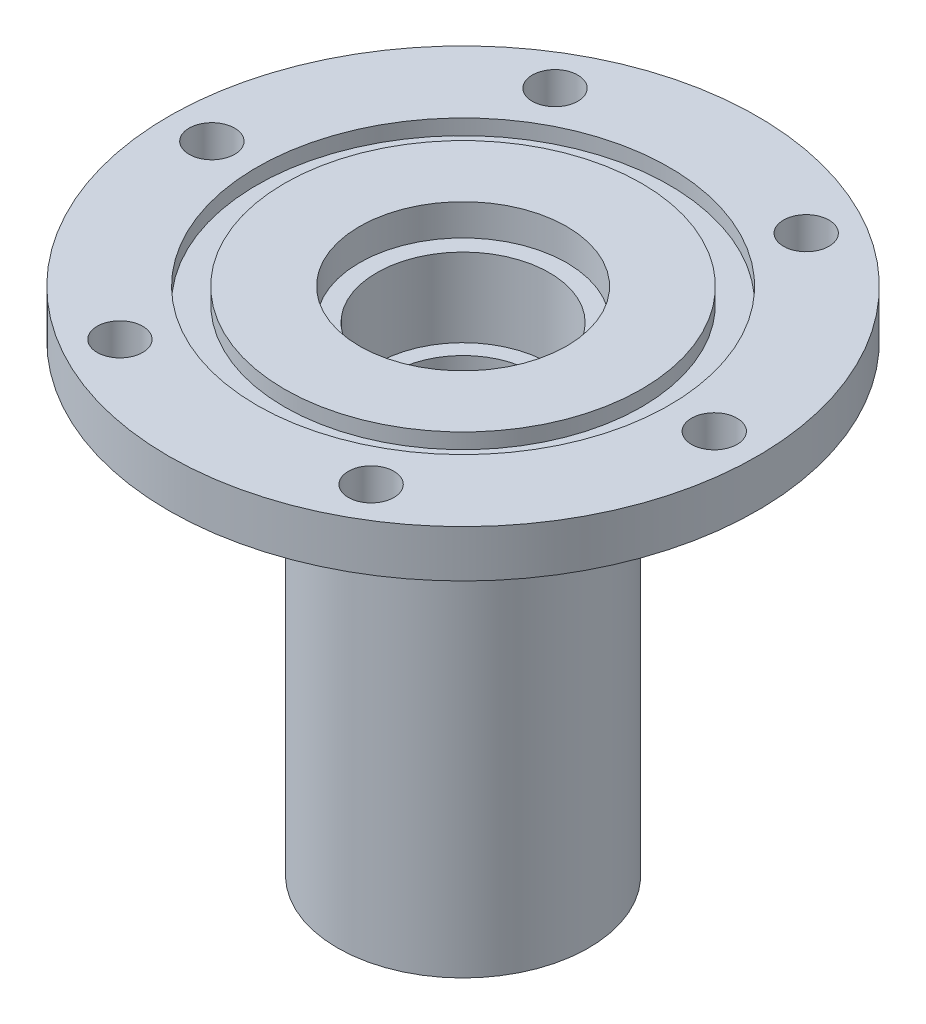
from build123d import *

# Parameters (mm, degrees)
M5_CLEARANCE_HOLE1_D = 5.8
FILLET1_R            = 5


with BuildPart() as part:
    # Sketch1 → Revolve1 (revolve)
    with BuildSketch(Plane.XY):
        Polygon((37.5, 0), (26.2636, 0), (26.2636, -1.9558), (22.733, -1.9558), (22.733, 0), (13.2, 0), (13.2, -4), (11, -4), (11, -14), (9, -14), (9, -17), (11, -17), (11, -30.5), (12.5, -30.5), (12.5, -65), (16, -65), (16, -6), (37.5, -6), align=None)
    revolve(axis=Axis((0, 0, 0), (0, -1, 0)))

    # M5 Clearance Hole1 (through all)
    with Locations(Plane(origin=(0, 0, 0), x_dir=(1, 0, 0), z_dir=(0, 1, 0))):
        with Locations((16, 27.712812921), (32, 0), (16, -27.712812921), (-16, -27.712812921), (-32, 0), (-16, 27.712812921)):
            Hole(M5_CLEARANCE_HOLE1_D / 2)

    # Fillet1
    fillet1_edges = [part.edges().sort_by_distance(p)[0] for p in [
        (-16, -6, 0),
    ]]
    fillet(fillet1_edges, radius=FILLET1_R)


solid = part.part
